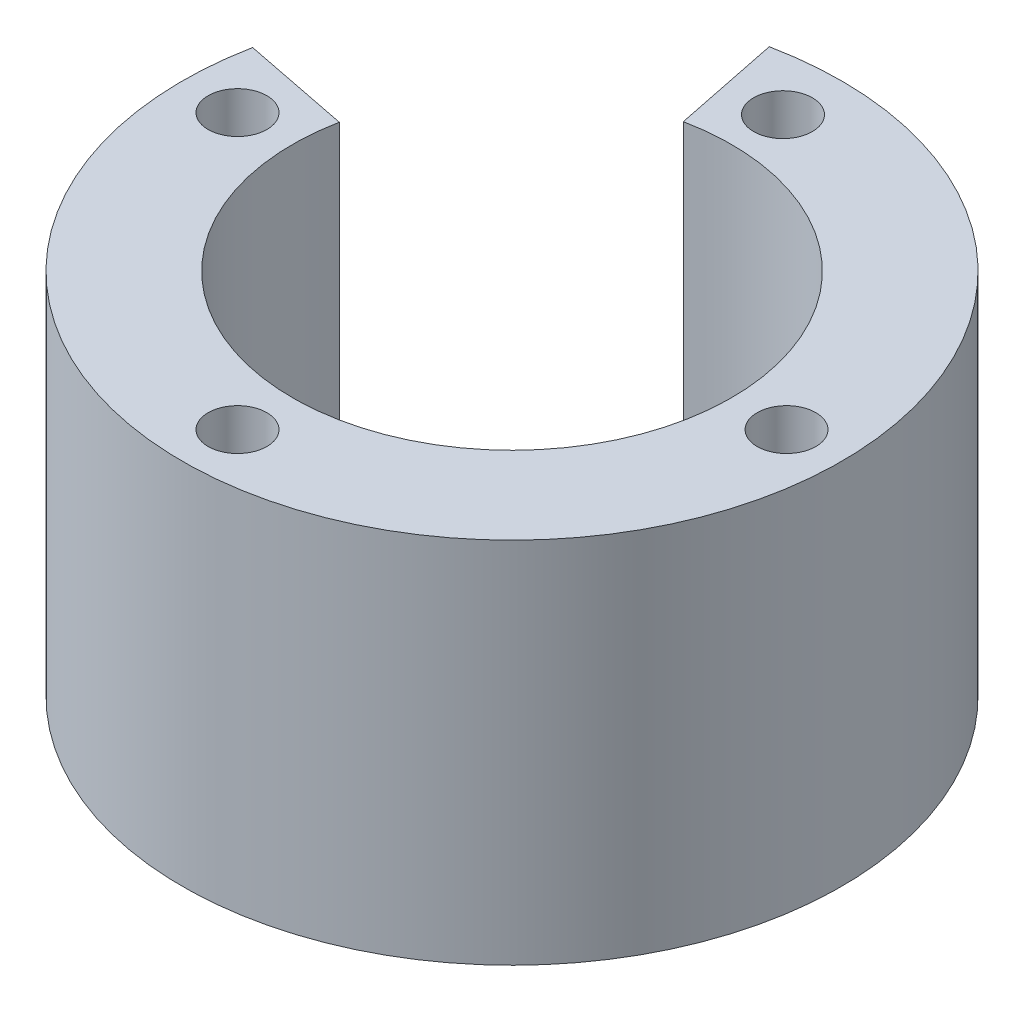
from build123d import *

# Parameters (mm, degrees)
SKETCH1_R           = 1.6
BOSS_EXTRUDE1_DEPTH = 20.066


with BuildPart() as part:
    # Sketch1 → Boss-Extrude1 (new body)
    with BuildSketch(Plane(origin=(0, 0, 0), x_dir=(1, 0, 0), z_dir=(0, 1, 0))):
        with BuildLine():
            Line((-3.581900814, 17.601594371), (-2.385431484, 11.722099398))
            ThreePointArc((-2.385431484, 11.722099398), (7.568438523, 9.263726895), (11.962353349, 0))
            ThreePointArc((11.962353349, 0), (-1.1655788, -11.90543253), (-11.735211766, 2.320065185))
            Line((-11.735211766, 2.320065185), (-17.621283556, 3.483748509))
            ThreePointArc((-17.621283556, 3.483748509), (-1.750202294, -17.876882552), (17.962353349, 0))
            ThreePointArc((17.962353349, 0), (11.364567078, 13.910167252), (-3.581900814, 17.601594371))
        make_face()
        with Locations((0, -14.962353349)):
            Circle(SKETCH1_R, mode=Mode.SUBTRACT)
        with Locations((-14.962353349, 0)):
            Circle(SKETCH1_R, mode=Mode.SUBTRACT)
        with Locations((14.962353349, 0)):
            Circle(SKETCH1_R, mode=Mode.SUBTRACT)
        with Locations((0, 14.768269285)):
            Circle(SKETCH1_R, mode=Mode.SUBTRACT)
    extrude(amount=BOSS_EXTRUDE1_DEPTH)


solid = part.part
